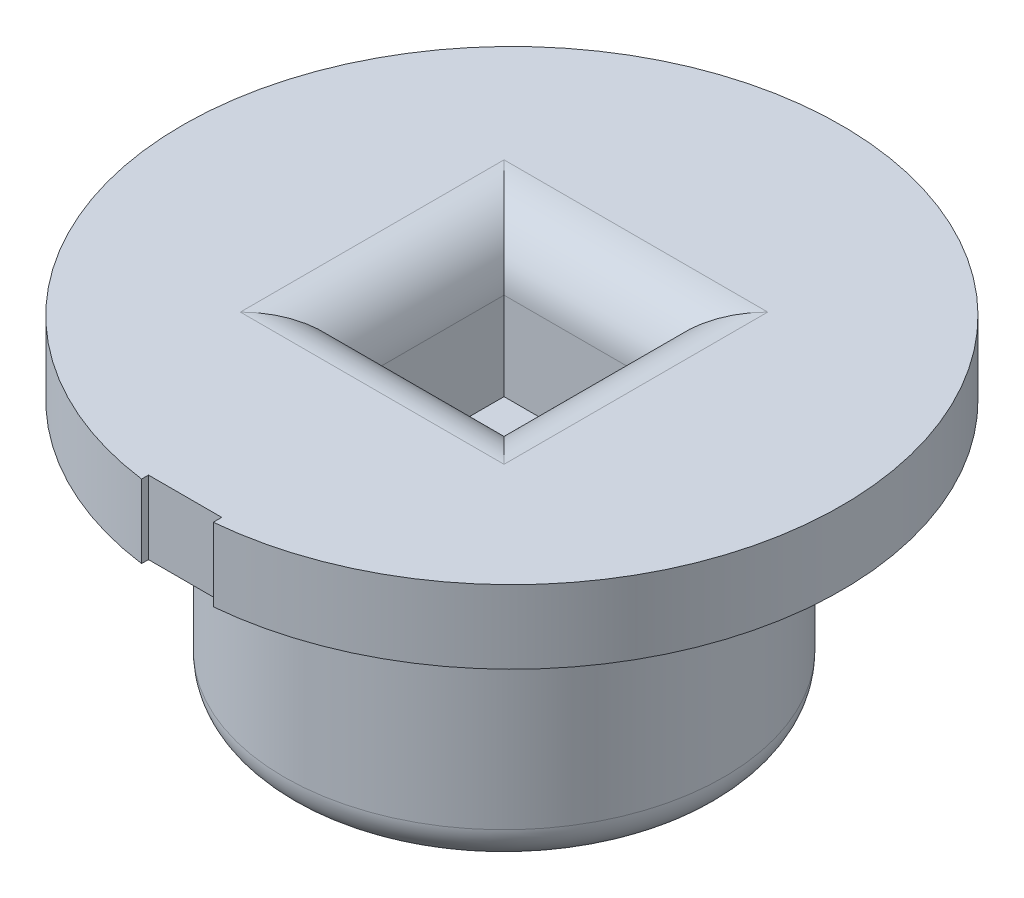
from build123d import *

# Parameters (mm, degrees)
SKETCH_1_R          = 3
EXTRUDE_1_DEPTH     = 3.5
SKETCH_2_R          = 4.5
EXTRUDE_2_DEPTH     = 1
SKETCH_4_W          = 2
SKETCH_4_H          = 2
CUT_EXTRUDE_1_DEPTH = 2
FILLET_1_R          = 0.5
FILLET_2_R          = 0.8
SKETCH_5_W          = 1
SKETCH_5_H          = 0.656693248
CUT_EXTRUDE_2_DEPTH = 1


with BuildPart() as part:
    # 草图1 → 凸台-拉伸1 (new body)
    with BuildSketch(Plane(origin=(0, 0, 0), x_dir=(1, 0, 0), z_dir=(0, 1, 0))):
        Circle(SKETCH_1_R)
    extrude(amount=EXTRUDE_1_DEPTH)

    # 草图2 → 凸台-拉伸2 (add)
    with BuildSketch(Plane(origin=(0, 3.5, 0), x_dir=(1, 0, 0), z_dir=(0, 1, 0))):
        with Locations((0.094879954, 0.012027373)):
            Circle(SKETCH_2_R)
    extrude(amount=EXTRUDE_2_DEPTH)

    # 草图4 → 切除-拉伸1 (cut)
    with BuildSketch(Plane(origin=(0, 4.5, 0), x_dir=(1, 0, 0), z_dir=(0, 1, 0))):
        Rectangle(SKETCH_4_W, SKETCH_4_H)
    extrude(amount=-CUT_EXTRUDE_1_DEPTH, mode=Mode.SUBTRACT)

    # 圆角1
    fillet_1_edges = [part.edges().sort_by_distance(p)[0] for p in [
        (-3, 0, 0),
    ]]
    fillet(fillet_1_edges, radius=FILLET_1_R)

    # 圆角2
    fillet_2_edges = [part.edges().sort_by_distance(p)[0] for p in [
        (0, 4.5, 1),
        (-1, 4.5, 0),
        (0, 4.5, -1),
        (1, 4.5, 0),
    ]]
    fillet(fillet_2_edges, radius=FILLET_2_R)

    # 草图5 → 切除-拉伸2 (cut)
    with BuildSketch(Plane.XZ.offset(-3.5)):
        with Locations((0, 4.682753302)):
            Rectangle(SKETCH_5_W, SKETCH_5_H)
    extrude(amount=-CUT_EXTRUDE_2_DEPTH, mode=Mode.SUBTRACT)


solid = part.part
